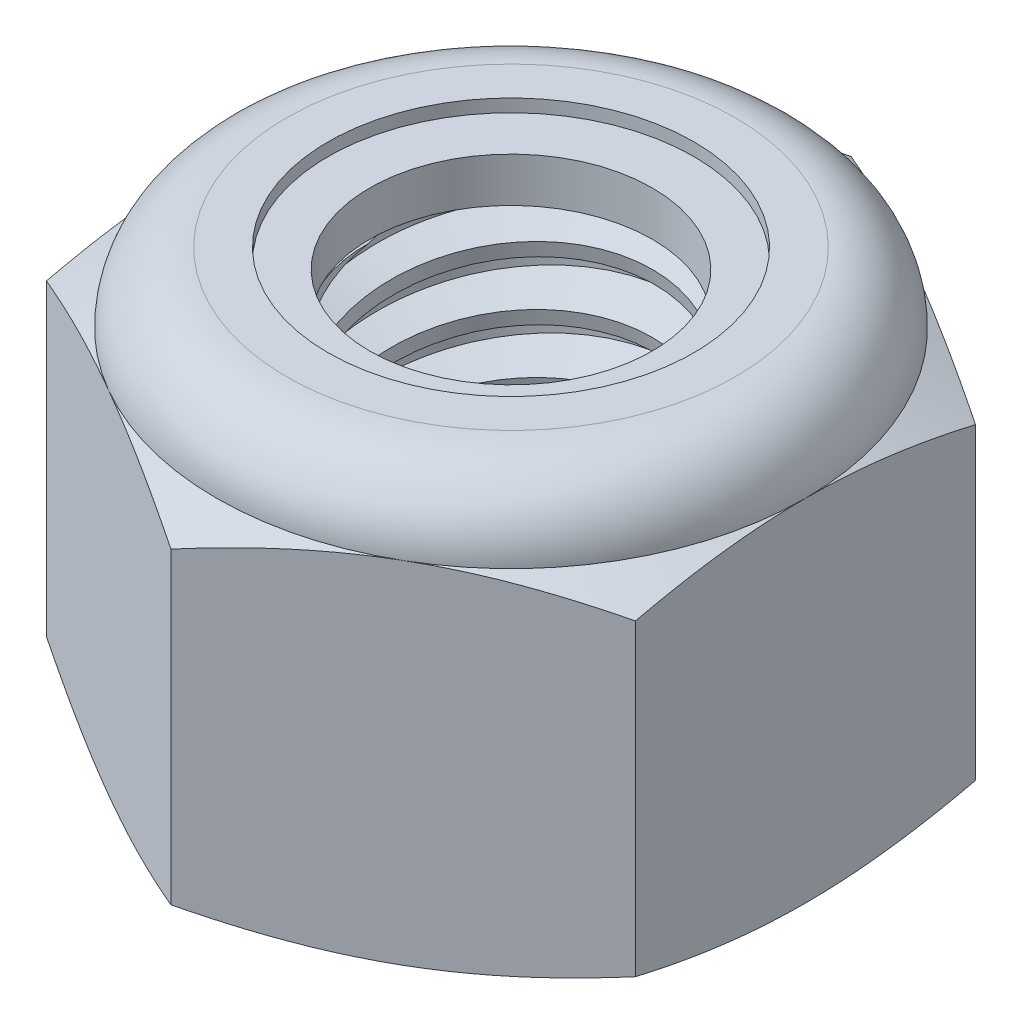
from build123d import *

# Parameters (mm, degrees)
EXTRUDE1_DEPTH       = 5
SKETCH2_W            = 2
SKETCH2_H            = 5
LPATTERN1_COUNT      = 7
LPATTERN1_PITCH      = 0.7
LPATTERN1_COUNT_DIR2 = 2
LPATTERN1_PITCH_DIR2 = 0.7


with BuildPart() as part:
    # Sketch1 → Extrude1 (new body)
    with BuildSketch(Plane(origin=(0, 0, 0), x_dir=(1, 0, 0), z_dir=(0, 1, 0))):
        Polygon((0, 4.041451884), (-3.5, 2.020725942), (-3.5, -2.020725942), (0, -4.041451884), (3.5, -2.020725942), (3.5, 2.020725942), align=None)
    extrude(amount=EXTRUDE1_DEPTH)

    # Sketch4 → Cut-Revolve2 (revolve, cut)
    with BuildSketch(Plane(origin=(0, 0, 0), x_dir=(0, 0, -1), z_dir=(1, 0, 0))):
        Polygon((0, 5), (2, 5), (1.679577111, 4.850584353), (1.679577111, 0.149415647), (2, 0), (0, 0), align=None)
    revolve(axis=Axis((0, 5, 0), (0, 1, 0)), mode=Mode.SUBTRACT)


with BuildPart() as body_2:
    # Sketch2 → Revolve1 (revolve)
    with BuildSketch(Plane(origin=(0, 0, 0), x_dir=(0, 0, -1), z_dir=(1, 0, 0))):
        with Locations((1, 2.5)):
            Rectangle(SKETCH2_W, SKETCH2_H)
    revolve(axis=Axis((0, -2, 0), (0, 1, 0)))

    # Sketch3 → Cut-Revolve1 (revolve, cut)
    with BuildSketch(Plane(origin=(0, 0, 0), x_dir=(0, 0, -1), z_dir=(1, 0, 0))):
        Polygon((2.015083279, 4.913809834), (2.120666232, 4.310478673), (1.709743669, 4.460641574), (1.679577111, 4.633021905), align=None)
    cut_revolve1 = revolve(axis=Axis((0, 5, 0.13120342), (0, -0.9850304671557041, -0.17238033175224876)), mode=Mode.SUBTRACT)

    # LPattern1: Cut-Revolve1 7 × 2
    with Locations(*[Vector(0, -1, 0) * (i * LPATTERN1_PITCH) + Vector(0, 1, 0) * (j * LPATTERN1_PITCH_DIR2) for i in range(LPATTERN1_COUNT) for j in range(LPATTERN1_COUNT_DIR2) if (i, j) != (0, 0)]):
        add(cut_revolve1, mode=Mode.SUBTRACT)


with BuildPart() as part_1:
    add(part.part)

    # Combine1: cut body 2
    add(body_2.part, mode=Mode.SUBTRACT)

    # Sketch5 → Cut-Revolve3 (revolve, cut)
    with BuildSketch(Plane(origin=(0, 0, 0), x_dir=(0, 0, -1), z_dir=(1, 0, 0))):
        with BuildLine():
            Line((0, 0), (3.5, 0))
            Line((3.5, 0), (4.041451884, 0.25248316))
            Line((4.041451884, 0.25248316), (4.041451884, 3.914183506))
            Line((4.041451884, 3.914183506), (3.5, 4.166666667))
            ThreePointArc((3.5, 4.166666667), (3.255922318, 4.755922318), (2.666666667, 5))
            Line((2.666666667, 5), (2.666666667, 6.27))
            Line((2.666666667, 6.27), (5.311451884, 6.27))
            Line((5.311451884, 6.27), (5.311451884, -1.27))
            Line((5.311451884, -1.27), (0, -1.27))
            Line((0, -1.27), (0, 0))
        make_face()
    revolve(axis=Axis((0, 0, 0), (0, 1, 0)), mode=Mode.SUBTRACT)

    # Sketch6 → Cut-Revolve4 (revolve, cut)
    with BuildSketch(Plane(origin=(0, 0, 0), x_dir=(0, 0, -1), z_dir=(1, 0, 0))):
        with BuildLine():
            Line((0, 4.166666667), (3.3476, 4.166666667))
            ThreePointArc((3.3476, 4.166666667), (3.148159244, 4.648159244), (2.666666667, 4.8476))
            Line((2.666666667, 4.8476), (2.173121889, 4.8476))
            Line((2.173121889, 4.8476), (2.173121889, 6.27))
            Line((2.173121889, 6.27), (0, 6.27))
            Line((0, 6.27), (0, 4.166666667))
        make_face()
    revolve(axis=Axis((0, 6.27, 0), (0, 1, 0)), mode=Mode.SUBTRACT)


with BuildPart() as body_2_2:
    # Sketch7 → Revolve2 (revolve)
    with BuildSketch(Plane(origin=(0, 0, 0), x_dir=(0, 0, -1), z_dir=(1, 0, 0))):
        with BuildLine():
            Line((1.679577111, 4.242866667), (3.266579964, 4.242866667))
            ThreePointArc((3.266579964, 4.242866667), (3.066430175, 4.620419399), (2.666666667, 4.7714))
            Line((2.666666667, 4.7714), (1.679577111, 4.7714))
            Line((1.679577111, 4.7714), (1.679577111, 4.242866667))
        make_face()
    revolve(axis=Axis((0, 4.242866667, 0), (0, 1, 0)))


solid = Compound([part_1.part, body_2_2.part])
